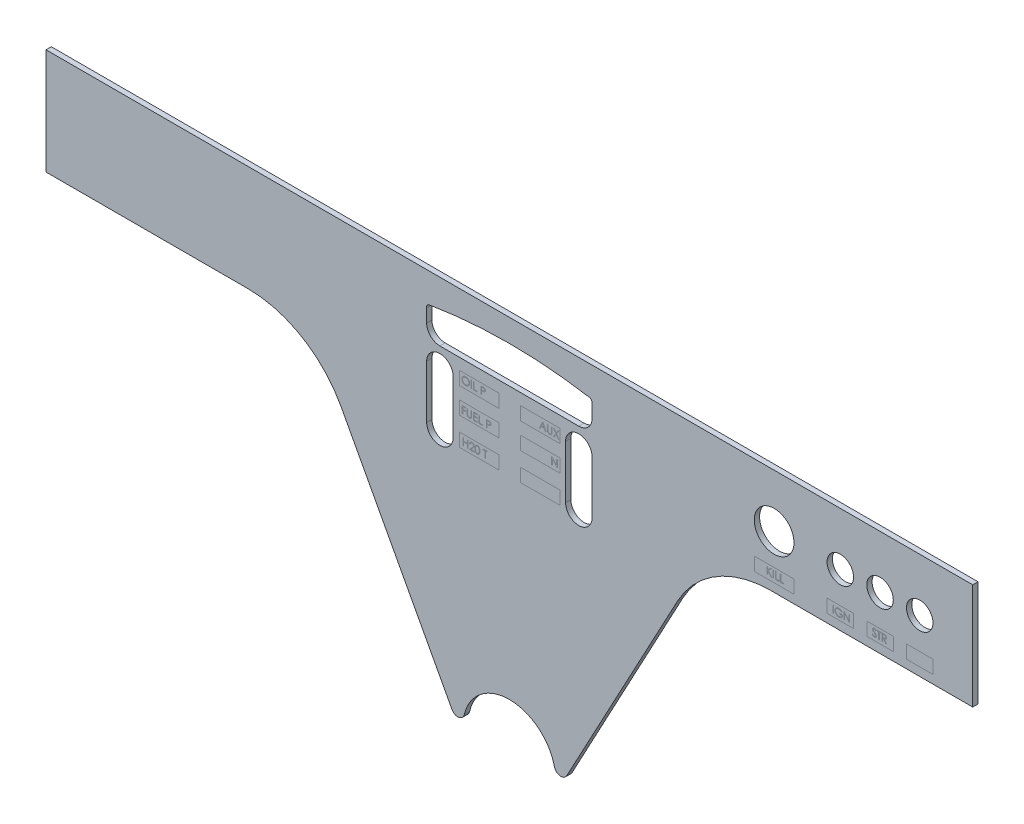
from build123d import *

# Parameters (mm, degrees)
BOSS_EXTRUDE1_DEPTH     = 2.54
FILLET1_R               = 50.8
FILLET2_R               = 3.175
CUT_EXTRUDE1_DEPTH      = 287.624257184
CUT_EXTRUDE1_DEPTH_BACK = 287.624257184
CUT_EXTRUDE2_DEPTH      = 287.624257184
CUT_EXTRUDE2_DEPTH_BACK = 287.624257184
SKETCH12_R              = 9.525
SKETCH12_R_2            = 6.35


with BuildPart() as part:
    # Sketch1 → Boss-Extrude1 (new body)
    with BuildSketch(Plane.XY):
        with BuildLine():
            Line((222.25, 180.975), (0, 180.975))
            Line((0, 180.975), (0, 22.225))
            ThreePointArc((0, 22.225), (15.715448212, 15.715448212), (22.225, 0))
            ThreePointArc((22.225, 0), (21.55540554, -5.414343637), (19.586969222, -10.502440749))
            Line((19.586969222, -10.502440749), (95.017551129, 130.175))
            Line((95.017551129, 130.175), (222.25, 130.175))
            Line((222.25, 130.175), (222.25, 180.975))
        make_face()
    boss_extrude1 = extrude(amount=BOSS_EXTRUDE1_DEPTH)

    # Mirror1: Boss-Extrude1 across plane
    add(boss_extrude1.mirror(Plane(origin=(0, 0, 2.54), x_dir=(0, 0, 1), z_dir=(1, 0, 0))))

    # Fillet1
    fillet1_edges = [part.edges().sort_by_distance(p)[0] for p in [
        (95.017551129, 130.175, 1.27),
        (-95.017551129, 130.175, 1.27),
    ]]
    fillet(fillet1_edges, radius=FILLET1_R)

    # Fillet2
    fillet2_edges = [part.edges().sort_by_distance(p)[0] for p in [
        (-19.586969222, -10.502440749, 1.27),
    ]]
    fillet(fillet2_edges, radius=FILLET2_R)
    fillet2_2_edges = [part.edges().sort_by_distance(p)[0] for p in [
        (19.586969222, -10.502440749, 1.27),
    ]]
    fillet(fillet2_2_edges, radius=FILLET2_R)

    # Sketch10 → Cut-Extrude1 (cut, two sides: drawn at the far end of the back side and taken through both)
    with BuildSketch(Plane.XY.offset(2.54).offset(-CUT_EXTRUDE1_DEPTH_BACK)):
        with BuildLine():
            Line((26.965603448, 142.875), (26.965603448, 117.475))
            ThreePointArc((26.965603448, 117.475), (33.315603448, 111.125), (39.665603448, 117.475))
            Line((39.665603448, 117.475), (39.665603448, 142.875))
            ThreePointArc((39.665603448, 142.875), (33.315603448, 149.225), (26.965603448, 142.875))
        make_face()
        with BuildLine():
            Line((-39.665603448, 142.875), (-39.665603448, 117.475))
            ThreePointArc((-39.665603448, 117.475), (-33.315603448, 111.125), (-26.965603448, 117.475))
            Line((-26.965603448, 117.475), (-26.965603448, 142.875))
            ThreePointArc((-26.965603448, 142.875), (-33.315603448, 149.225), (-39.665603448, 142.875))
        make_face()
        with BuildLine():
            Line((39.665603448, 158.75), (39.665603448, 165.1))
            ThreePointArc((39.665603448, 165.1), (39.392847217, 166.284009033), (38.362758621, 166.928362069))
            ThreePointArc((38.362758621, 166.928362069), (0, 170.125258621), (-38.362758621, 166.928362069))
            ThreePointArc((-38.362758621, 166.928362069), (-39.392847217, 166.284009033), (-39.665603448, 165.1))
            Line((-39.665603448, 165.1), (-39.665603448, 158.75))
            ThreePointArc((-39.665603448, 158.75), (-37.805731509, 154.259871939), (-33.315603448, 152.4))
            Line((-33.315603448, 152.4), (33.315603448, 152.4))
            ThreePointArc((33.315603448, 152.4), (37.805731509, 154.259871939), (39.665603448, 158.75))
        make_face()
    extrude(amount=CUT_EXTRUDE1_DEPTH + CUT_EXTRUDE1_DEPTH_BACK, mode=Mode.SUBTRACT)

    # Sketch12 → Cut-Extrude2 (cut, two sides: drawn at the far end of the back side and taken through both)
    with BuildSketch(Plane.XY.offset(-CUT_EXTRUDE2_DEPTH_BACK)):
        with Locations((127, 155.575)):
            Circle(SKETCH12_R)
        with Locations((158.75, 155.575)):
            Circle(SKETCH12_R_2)
        with Locations((177.8, 155.575)):
            Circle(SKETCH12_R_2)
        with Locations((196.85, 155.575)):
            Circle(SKETCH12_R_2)
    extrude(amount=CUT_EXTRUDE2_DEPTH + CUT_EXTRUDE2_DEPTH_BACK, mode=Mode.SUBTRACT)


solid = part.part
